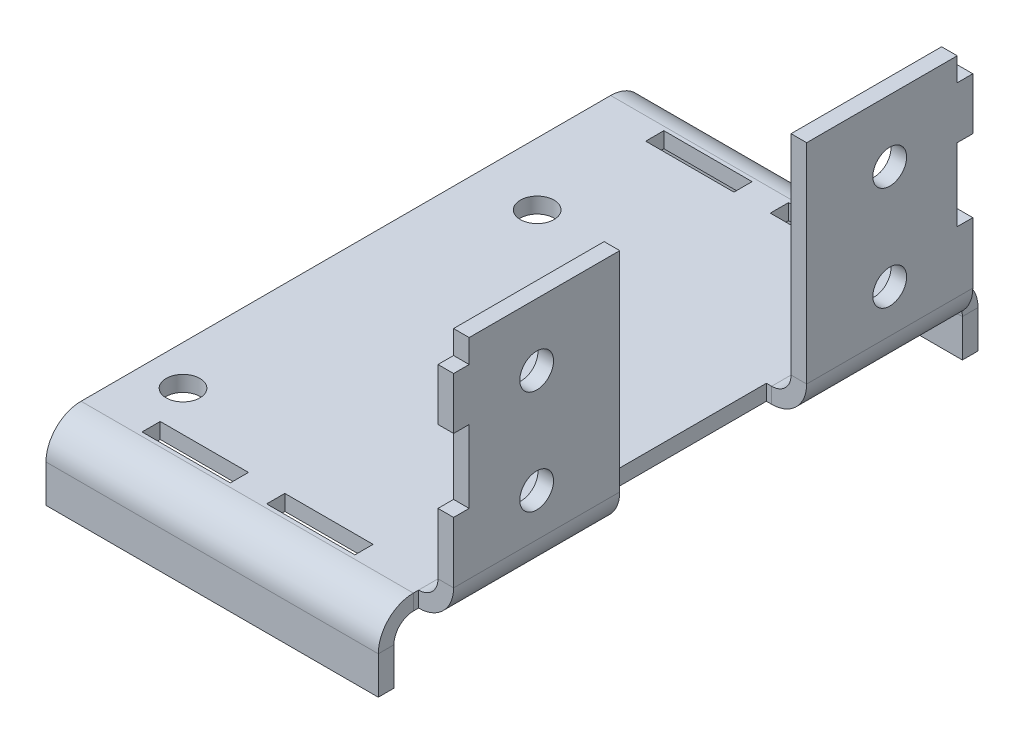
from build123d import *

# Parameters (mm, degrees)
BASE_FLANGE1_DEPTH      = 4.7752
EDGE_FLANGE1_DEPTH      = 50.8
EDGE_FLANGE1_BEND_DEPTH = 50.8
EDGE_FLANGE2_DEPTH      = 101.6
EDGE_FLANGE2_BEND_DEPTH = 101.6
SKETCH18_R              = 5.159375
SKETCH18_W              = 4.7625
SKETCH18_H              = 22.225
CUT_EXTRUDE1_DEPTH      = 158.639173972
SKETCH19_W              = 26.9875
SKETCH19_H              = 5.55625
CUT_EXTRUDE2_DEPTH      = 131.648559208
CUT_EXTRUDE3_DEPTH      = 131.648559208
CUT_EXTRUDE3_DEPTH_BACK = 131.648559208
SKETCH20_R              = 5.159375


# Sheet-metal steps are written as plain solids
with BuildPart() as part:
    # Sketch1 → Base-Flange1 (new body)
    with BuildSketch(Plane(origin=(0, 0, 0), x_dir=(1, 0, 0), z_dir=(0, 1, 0))):
        Polygon((49.2125, -28.575), (49.2125, 28.575), (50.8, 28.575), (50.8, 79.375), (-50.8, 79.375), (-50.8, -79.375), (50.8, -79.375), (50.8, -28.575), align=None)
    extrude(amount=-BASE_FLANGE1_DEPTH)

    # Edge-Flange1 section (across the edge) → Edge-Flange1 (add)
    with BuildSketch(Plane(origin=(56.7436, 0, -28.575), x_dir=(-1, 0, 0), z_dir=(0, 0, -1))):
        with BuildLine():
            Line((-4.7752, 5.9436), (-4.7752, 69.85))
            Line((-4.7752, 69.85), (0, 69.85))
            Line((0, 69.85), (0, 5.9436))
            ThreePointArc((0, 5.9436), (1.740840135, 1.740840135), (5.9436, 0))
            Line((5.9436, 0), (5.9436, -4.7752))
            ThreePointArc((5.9436, -4.7752), (-1.635736166, -1.635736166), (-4.7752, 5.9436))
        make_face()
    extrude(amount=EDGE_FLANGE1_DEPTH)

    # Edge-Flange1 section 2 (across the edge) → Edge-Flange1 bend (add)
    with BuildSketch(Plane(origin=(56.7436, 0, 79.375), x_dir=(-1, 0, 0), z_dir=(0, 0, -1))):
        with BuildLine():
            Line((-4.7752, 5.9436), (-4.7752, 69.85))
            Line((-4.7752, 69.85), (0, 69.85))
            Line((0, 69.85), (0, 5.9436))
            ThreePointArc((0, 5.9436), (1.740840135, 1.740840135), (5.9436, 0))
            Line((5.9436, 0), (5.9436, -4.7752))
            ThreePointArc((5.9436, -4.7752), (-1.635736166, -1.635736166), (-4.7752, 5.9436))
        make_face()
    extrude(amount=EDGE_FLANGE1_BEND_DEPTH)

    # Edge-Flange2 section (across the edge) → Edge-Flange2 (add)
    with BuildSketch(Plane(origin=(50.8, -4.7752, 86.9061), x_dir=(0, 0, -1), z_dir=(-1, 0, 0))):
        with BuildLine():
            Line((-4.7752, 5.9436), (-4.7752, 17.4498))
            Line((-4.7752, 17.4498), (0, 17.4498))
            Line((0, 17.4498), (0, 5.9436))
            ThreePointArc((0, 5.9436), (1.740840135, 1.740840135), (5.9436, 0))
            Line((5.9436, 0), (7.5311, 0))
            Line((7.5311, 0), (7.5311, -4.7752))
            Line((7.5311, -4.7752), (5.9436, -4.7752))
            ThreePointArc((5.9436, -4.7752), (-1.635736166, -1.635736166), (-4.7752, 5.9436))
        make_face()
    extrude(amount=EDGE_FLANGE2_DEPTH)

    # Edge-Flange2 section 2 (across the edge) → Edge-Flange2 bend (add)
    with BuildSketch(Plane(origin=(-50.8, -4.7752, -86.9061), x_dir=(0, 0, 1), z_dir=(1, 0, 0))):
        with BuildLine():
            Line((-4.7752, 5.9436), (-4.7752, 17.4498))
            Line((-4.7752, 17.4498), (0, 17.4498))
            Line((0, 17.4498), (0, 5.9436))
            ThreePointArc((0, 5.9436), (1.740840135, 1.740840135), (5.9436, 0))
            Line((5.9436, 0), (7.5311, 0))
            Line((7.5311, 0), (7.5311, -4.7752))
            Line((7.5311, -4.7752), (5.9436, -4.7752))
            ThreePointArc((5.9436, -4.7752), (-1.635736166, -1.635736166), (-4.7752, 5.9436))
        make_face()
    extrude(amount=EDGE_FLANGE2_BEND_DEPTH)

    # Sketch18 → Cut-Extrude1 (cut, symmetric)
    with BuildSketch(Plane.ZY.offset(-56.7436)):
        with Locations(Location((-53.975, 50.8, 0), (0, 0, 270))):
            Circle(SKETCH18_R)
        with Locations(Location((-53.975, 19.05, 0), (0, 0, 270))):
            Circle(SKETCH18_R)
        with Locations((-76.99375, 73.81875)):
            Rectangle(SKETCH18_W, SKETCH18_H)
        with Locations((-76.99375, 35.71875)):
            Rectangle(SKETCH18_W, SKETCH18_H)
    cut_extrude1 = extrude(amount=CUT_EXTRUDE1_DEPTH, both=True, mode=Mode.SUBTRACT)

    # Sketch19 → Cut-Extrude2 (cut, symmetric)
    with BuildSketch(Plane(origin=(0, 0, 0), x_dir=(1, 0, 0), z_dir=(0, 1, 0))):
        with Locations((-19.853275, 76.99375)):
            Rectangle(SKETCH19_W, SKETCH19_H)
        with Locations((18.246725, 76.99375)):
            Rectangle(SKETCH19_W, SKETCH19_H)
    cut_extrude2 = extrude(amount=CUT_EXTRUDE2_DEPTH, both=True, mode=Mode.SUBTRACT)

    # Sketch20 → Cut-Extrude3 (cut, two sides: drawn at the far end of the back side and taken through both)
    with BuildSketch(Plane(origin=(0, 0, 0), x_dir=(1, 0, 0), z_dir=(0, 1, 0)).offset(-CUT_EXTRUDE3_DEPTH_BACK)):
        with Locations((-101.437452915, 44.213567876)):
            Circle(SKETCH20_R)
        with Locations(Location((-31.75, 39.451067876, 0), (0, 0, 270))):
            Circle(SKETCH20_R)
        with Locations(Location((-38.677272727, -61.9125, 0), (0, 0, 270))):
            Circle(SKETCH20_R)
        with Locations((-108.364725642, -57.15)):
            Circle(SKETCH20_R)
    extrude(amount=CUT_EXTRUDE3_DEPTH + CUT_EXTRUDE3_DEPTH_BACK, mode=Mode.SUBTRACT)

    # Mirror1: Cut-Extrude1, Cut-Extrude2 across plane
    add(cut_extrude1.mirror(Plane.XY), mode=Mode.SUBTRACT)
    add(cut_extrude2.mirror(Plane.XY), mode=Mode.SUBTRACT)


solid = part.part
